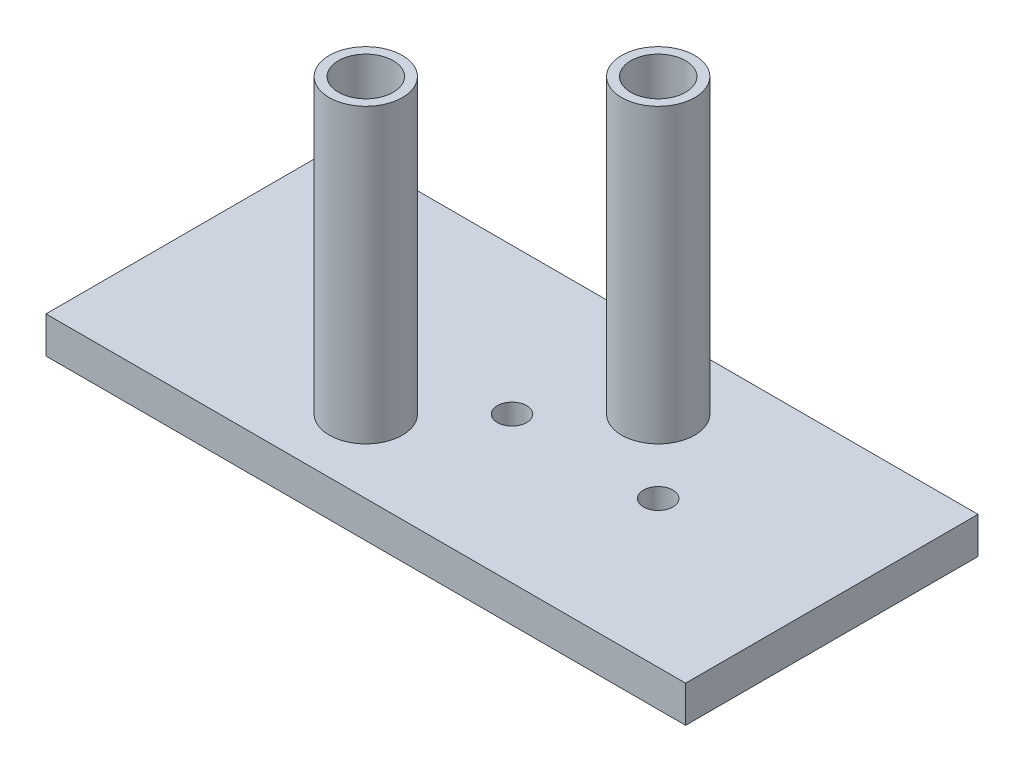
from build123d import *

# Parameters (mm, degrees)
SKETCH1_W           = 111.125
SKETCH1_H           = 50.8
BOSS_EXTRUDE1_DEPTH = 6.35
SKETCH2_R           = 6.35
SKETCH2_R_2         = 4.7625
BOSS_EXTRUDE2_DEPTH = 50.8
SKETCH2_9_R         = 2.5527
CUT_EXTRUDE1_DEPTH  = 133.325529


with BuildPart() as part:
    # Sketch1 → Boss-Extrude1 (new body)
    with BuildSketch(Plane(origin=(0, 0, 0), x_dir=(1, 0, 0), z_dir=(0, 1, 0))):
        with Locations((-55.5625, -25.4)):
            Rectangle(SKETCH1_W, SKETCH1_H)
    extrude(amount=BOSS_EXTRUDE1_DEPTH)

    # Sketch2 → Boss-Extrude2 (add)
    # profile 1 of 2: a face of its own
    with BuildSketch(Plane(origin=(0, 6.35, 0), x_dir=(1, 0, 0), z_dir=(0, 1, 0))):
        with Locations((-42.8625, -12.7)):
            Circle(SKETCH2_R)
        with Locations((-42.8625, -12.7)):
            Circle(SKETCH2_R_2, mode=Mode.SUBTRACT)
    # profile 2 of 2: a face of its own
    with BuildSketch(Plane(origin=(0, 6.35, 0), x_dir=(1, 0, 0), z_dir=(0, 1, 0))):
        with Locations((-68.2625, -38.1)):
            Circle(SKETCH2_R)
        with Locations((-68.2625, -38.1)):
            Circle(SKETCH2_R_2, mode=Mode.SUBTRACT)
    extrude(amount=BOSS_EXTRUDE2_DEPTH)

    # Sketch2<9> → Cut-Extrude1 (cut, through all)
    with BuildSketch(Plane(origin=(0, 6.35, 0), x_dir=(1, 0, 0), z_dir=(0, 1, 0))):
        with Locations((-55.5625, -25.4)):
            Circle(SKETCH2_9_R)
        with Locations((-30.1625, -25.4)):
            Circle(SKETCH2_9_R)
        with Locations((-80.9625, -25.4)):
            Circle(SKETCH2_9_R)
    extrude(amount=-CUT_EXTRUDE1_DEPTH, mode=Mode.SUBTRACT)


solid = part.part
